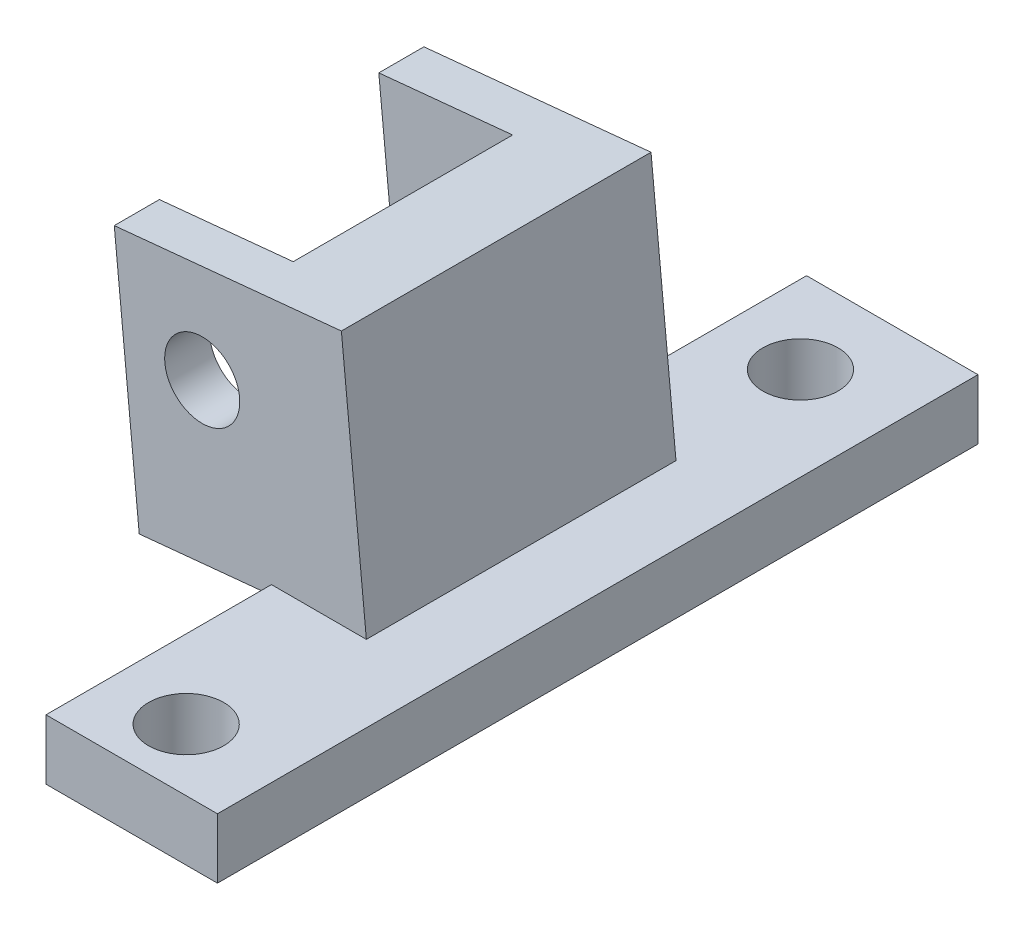
from build123d import *

# Parameters (mm, degrees)
BOSS_EXTRUDE5_DEPTH = 22.352
BOSS_EXTRUDE7_START = -3.81
SKETCH2_R           = 3.175
BOSS_EXTRUDE7_DEPTH = 3.81
BOSS_EXTRUDE8_START = 3.81
SKETCH3_R           = 3.175
BOSS_EXTRUDE8_DEPTH = 3.81
SKETCH4_W           = 14.486328335
SKETCH4_H           = 64.262
BOSS_EXTRUDE9_DEPTH = 5.08
SKETCH6_R           = 3.175
CUT_EXTRUDE1_DEPTH  = 6.35


with BuildPart() as part:
    # Sketch1 → Boss-Extrude5 (new body)
    with BuildSketch(Plane.XY):
        with BuildLine():
            Line((485.284620904, 141.520479852), (478.661596161, 140.870936716))
            Line((478.661596161, 140.870936716), (479.033472001, 137.079128657))
            Line((479.033472001, 137.079128657), (498.224726786, 138.961281946))
            Line((498.224726786, 138.961281946), (496.114951182, 160.473473003))
            Line((496.114951182, 160.473473003), (488.231748542, 159.700339826))
            ThreePointArc((488.231748542, 159.700339826), (489.092376455, 159.263306748), (489.904354663, 158.741416237))
            ThreePointArc((489.904354663, 158.741416237), (493.83445145, 151.929689602), (491.302607825, 144.484217934))
            ThreePointArc((491.302607825, 144.484217934), (488.563156596, 142.455032775), (485.284620904, 141.520479852))
        make_face()
    extrude(amount=-BOSS_EXTRUDE5_DEPTH)

    # Sketch2 → Boss-Extrude7 (add)
    with BuildSketch(Plane(origin=(0, 0, -22.352), x_dir=(-1, 0, 0), z_dir=(0, 0, -1)).offset(BOSS_EXTRUDE7_START)):
        with BuildLine():
            Line((-476.923696397, 158.591319714), (-488.231748542, 159.700339826))
            ThreePointArc((-488.231748542, 159.700339826), (-493.757189232, 149.475804861), (-485.284620904, 141.520479852))
            Line((-485.284620904, 141.520479852), (-478.661596161, 140.870936716))
            Line((-478.661596161, 140.870936716), (-476.923696397, 158.591319714))
        make_face()
        with Locations((-484.354931302, 151)):
            Circle(SKETCH2_R, mode=Mode.SUBTRACT)
    extrude(amount=BOSS_EXTRUDE7_DEPTH)

    # Sketch3 → Boss-Extrude8 (add)
    with BuildSketch(Plane.XY.offset(BOSS_EXTRUDE8_START)):
        Polygon((476.923696397, 158.591319714), (479.033472001, 137.079128657), (498.224726786, 138.961281946), (496.114951182, 160.473473003), align=None)
        with Locations((484.354931302, 151)):
            Circle(SKETCH3_R, mode=Mode.SUBTRACT)
    extrude(amount=-BOSS_EXTRUDE8_DEPTH)

    # Sketch4 → Boss-Extrude9 (add)
    with BuildSketch(Plane(origin=(0, 138.961281946, 0), x_dir=(1, 0, 0), z_dir=(0, 1, 0))):
        with Locations((497.449325337, 9.271)):
            Rectangle(SKETCH4_W, SKETCH4_H)
    extrude(amount=-BOSS_EXTRUDE9_DEPTH)

    # Sketch6 → Cut-Extrude1 (cut)
    with BuildSketch(Plane(origin=(0, 138.961281946, 0), x_dir=(1, 0, 0), z_dir=(0, 1, 0))):
        with Locations((496.810161169, -17.621203043)):
            Circle(SKETCH6_R)
        with Locations((496.810161169, 34.281579241)):
            Circle(SKETCH6_R)
    extrude(amount=-CUT_EXTRUDE1_DEPTH, mode=Mode.SUBTRACT)


solid = part.part
